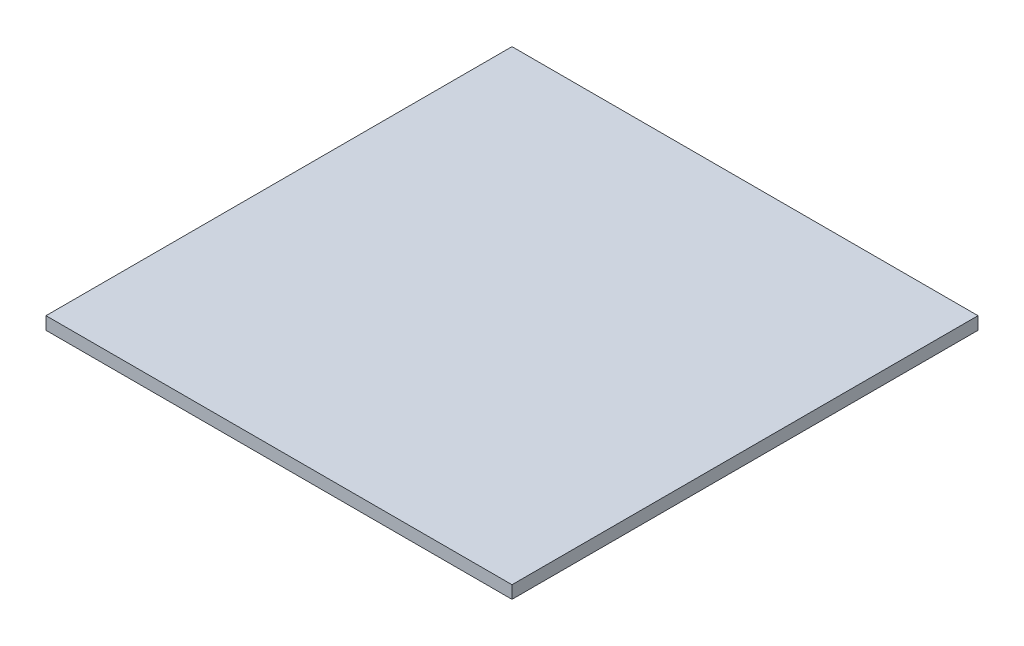
from build123d import *

# Parameters (mm, degrees)
SKETCH2_W           = 220
SKETCH2_H           = 220
BOSS_EXTRUDE1_DEPTH = 6


with BuildPart() as part:
    # Sketch2 → Boss-Extrude1 (new body)
    with BuildSketch(Plane(origin=(0, 0, 0), x_dir=(1, 0, 0), z_dir=(0, 1, 0))):
        with Locations((-604.222894392, 102.339948834)):
            Rectangle(SKETCH2_W, SKETCH2_H)
    extrude(amount=BOSS_EXTRUDE1_DEPTH)


solid = part.part
